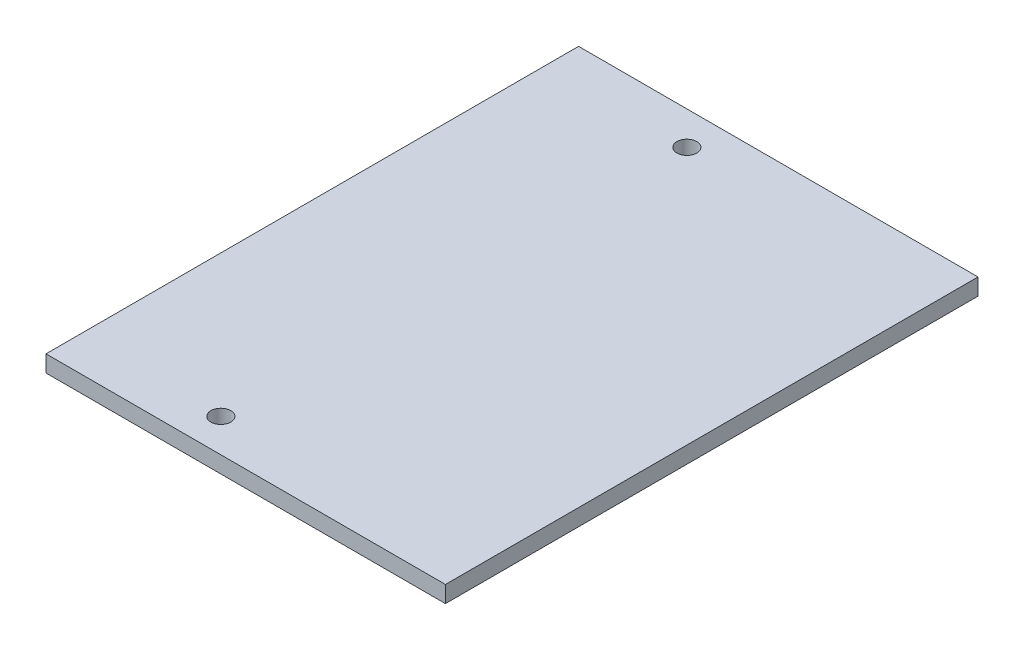
from build123d import *

# Parameters (mm, degrees)
SKETCH1_W             = 76.2
SKETCH1_H             = 101.6
BOSS_EXTRUDE1_DEPTH   = 3.175
F_6_CLEARANCE_HOLE1_D = 3.7973


with BuildPart() as part:
    # Sketch1 → Boss-Extrude1 (new body)
    with BuildSketch(Plane(origin=(0, 0, 0), x_dir=(1, 0, 0), z_dir=(0, 1, 0))):
        Rectangle(SKETCH1_W, SKETCH1_H)
    extrude(amount=BOSS_EXTRUDE1_DEPTH)

    # #6 Clearance Hole1 (through all)
    with Locations(Plane(origin=(-11.08964, 3.175, -44.45), x_dir=(0, 0, 1), z_dir=(0, 1, 0))):
        with Locations((0, 0), (88.9, 0)):
            Hole(F_6_CLEARANCE_HOLE1_D / 2)


solid = part.part
